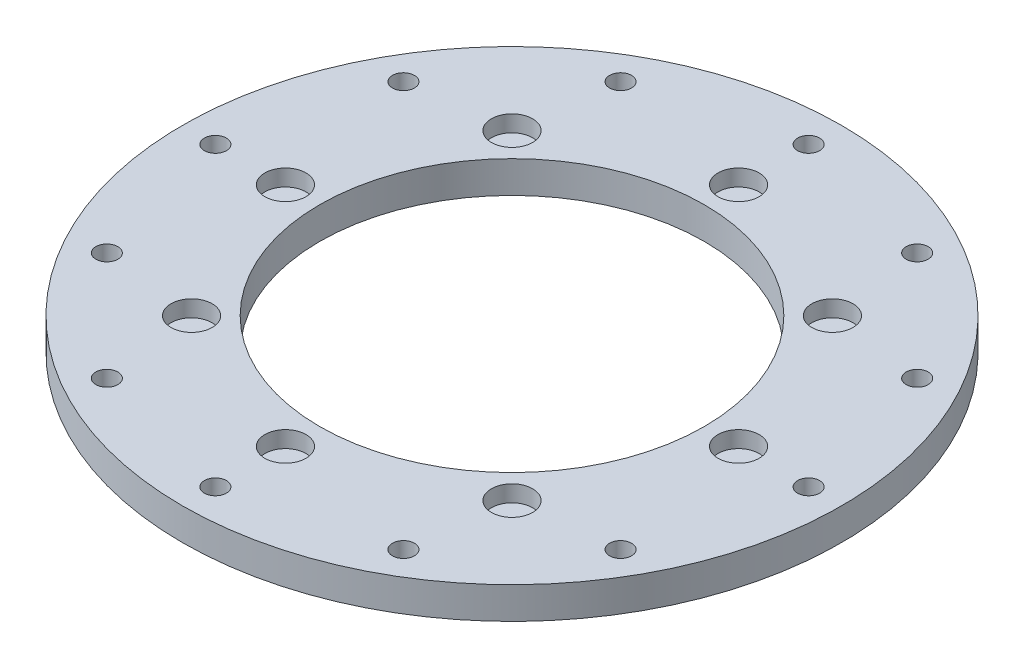
from build123d import *

# Parameters (mm, degrees)
SKETCH1_R           = 60
SKETCH1_R_2         = 35
BOSS_EXTRUDE1_DEPTH = 5.8
SKETCH3_R           = 2
CUT_EXTRUDE2_DEPTH  = 86.050808344
SKETCH4_R           = 3.75
CUT_EXTRUDE3_DEPTH  = 3


with BuildPart() as part:
    # Sketch1 → Boss-Extrude1 (new body)
    with BuildSketch(Plane(origin=(0, 0, 0), x_dir=(1, 0, 0), z_dir=(0, 1, 0))):
        Circle(SKETCH1_R)
        Circle(SKETCH1_R_2, mode=Mode.SUBTRACT)
    extrude(amount=BOSS_EXTRUDE1_DEPTH)

    # Sketch3 → Cut-Extrude2 (cut, through all)
    with BuildSketch(Plane(origin=(0, 5.8, 0), x_dir=(1, 0, 0), z_dir=(0, 1, 0))):
        with Locations((0, 54)):
            Circle(SKETCH3_R)
        with Locations((27, 46.765371804)):
            Circle(SKETCH3_R)
        with Locations((46.765371804, 27)):
            Circle(SKETCH3_R)
        with Locations((54, 0)):
            Circle(SKETCH3_R)
        with Locations((46.765371804, -27)):
            Circle(SKETCH3_R)
        with Locations((27, -46.765371804)):
            Circle(SKETCH3_R)
        with Locations((0, -54)):
            Circle(SKETCH3_R)
        with Locations((-27, -46.765371804)):
            Circle(SKETCH3_R)
        with Locations((-46.765371804, -27)):
            Circle(SKETCH3_R)
        with Locations((-54, 0)):
            Circle(SKETCH3_R)
        with Locations((-46.765371804, 27)):
            Circle(SKETCH3_R)
        with Locations((-27, 46.765371804)):
            Circle(SKETCH3_R)
    extrude(amount=-CUT_EXTRUDE2_DEPTH, mode=Mode.SUBTRACT)

    # Sketch4 → Cut-Extrude3 (cut)
    with BuildSketch(Plane(origin=(0, 5.8, 0), x_dir=(1, 0, 0), z_dir=(0, 1, 0))):
        with Locations((41.25, 0)):
            Circle(SKETCH4_R)
        with Locations((29.168154724, -29.168154724)):
            Circle(SKETCH4_R)
        with Locations((0, -41.25)):
            Circle(SKETCH4_R)
        with Locations((-29.168154724, -29.168154724)):
            Circle(SKETCH4_R)
        with Locations((-41.25, 0)):
            Circle(SKETCH4_R)
        with Locations((-29.168154724, 29.168154724)):
            Circle(SKETCH4_R)
        with Locations((0, 41.25)):
            Circle(SKETCH4_R)
        with Locations((29.168154724, 29.168154724)):
            Circle(SKETCH4_R)
    extrude(amount=-CUT_EXTRUDE3_DEPTH, mode=Mode.SUBTRACT)


solid = part.part
